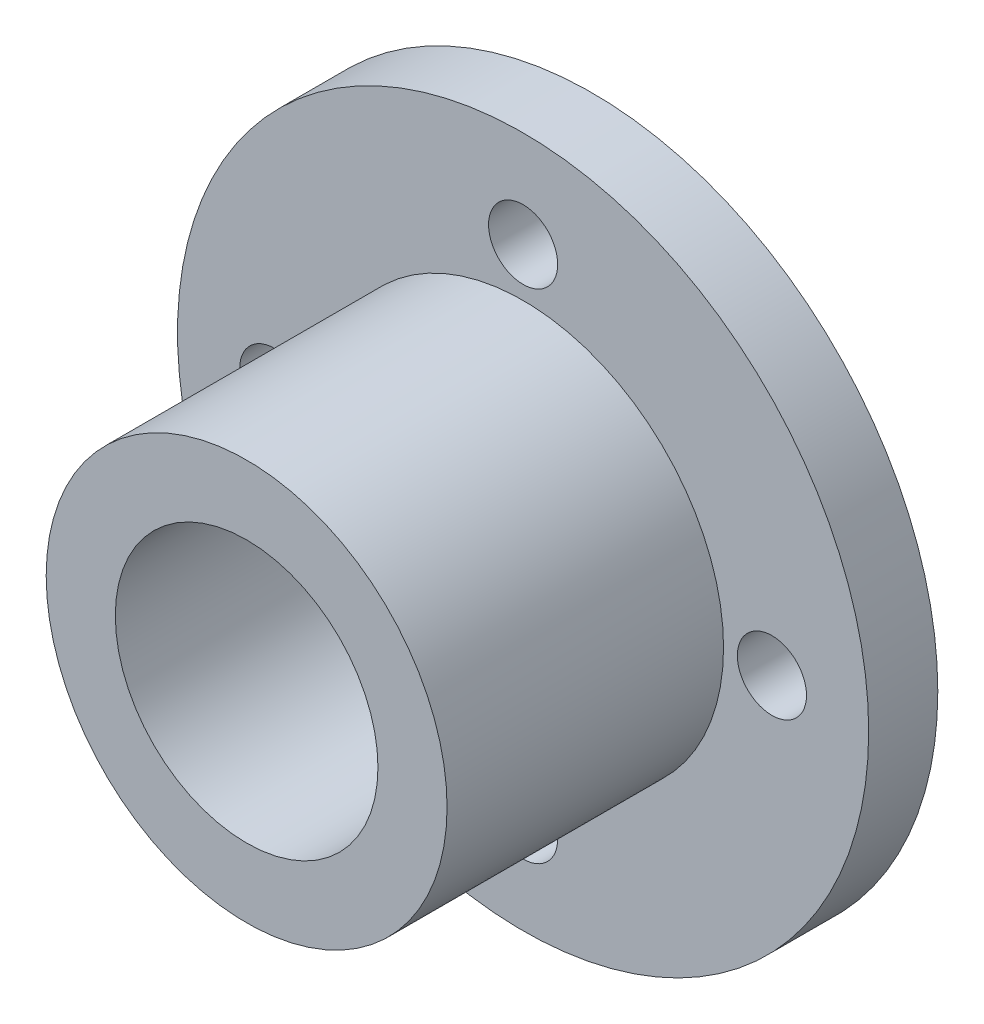
from build123d import *
from build123d.topology import SkipClean

# Parameters (mm, degrees)
SKETCH1_R           = 25
BOSS_EXTRUDE1_DEPTH = 5
SKETCH2_R           = 14.5
SKETCH2_R_2         = 9.5
BOSS_EXTRUDE2_DEPTH = 20
SKETCH3_R           = 9.5
CUT_EXTRUDE1_DEPTH  = 15
SKETCH4_R           = 2.5
CUT_EXTRUDE2_DEPTH  = 10


with BuildPart() as part:
    # Sketch1 → Boss-Extrude1 (new body)
    with BuildSketch(Plane.XY):
        Circle(SKETCH1_R)
    extrude(amount=BOSS_EXTRUDE1_DEPTH)

    # Sketch2 → Boss-Extrude2 (add)
    with BuildSketch(Plane.XY.offset(5)):
        Circle(SKETCH2_R)
        Circle(SKETCH2_R_2, mode=Mode.SUBTRACT)
    extrude(amount=BOSS_EXTRUDE2_DEPTH)

    # Sketch3 → Cut-Extrude1 (cut)
    with SkipClean():  # the faces are left unmerged after this step: merging them gives an invalid solid
        with BuildSketch(Plane(origin=(0, 0, 0), x_dir=(-1, 0, 0), z_dir=(0, 0, -1))):
            Circle(SKETCH3_R)
        extrude(amount=-CUT_EXTRUDE1_DEPTH, mode=Mode.SUBTRACT)
    add(part.part.scale(1), mode=Mode.REPLACE)  # the faces are merged on a copy

    # Sketch4 → Cut-Extrude2 (cut)
    with BuildSketch(Plane(origin=(0, 0, 0), x_dir=(-1, 0, 0), z_dir=(0, 0, -1))):
        with Locations((0, 18)):
            Circle(SKETCH4_R)
        with Locations((18, 0)):
            Circle(SKETCH4_R)
        with Locations((0, -18)):
            Circle(SKETCH4_R)
        with Locations((-18, 0)):
            Circle(SKETCH4_R)
    extrude(amount=-CUT_EXTRUDE2_DEPTH, mode=Mode.SUBTRACT)


solid = part.part
